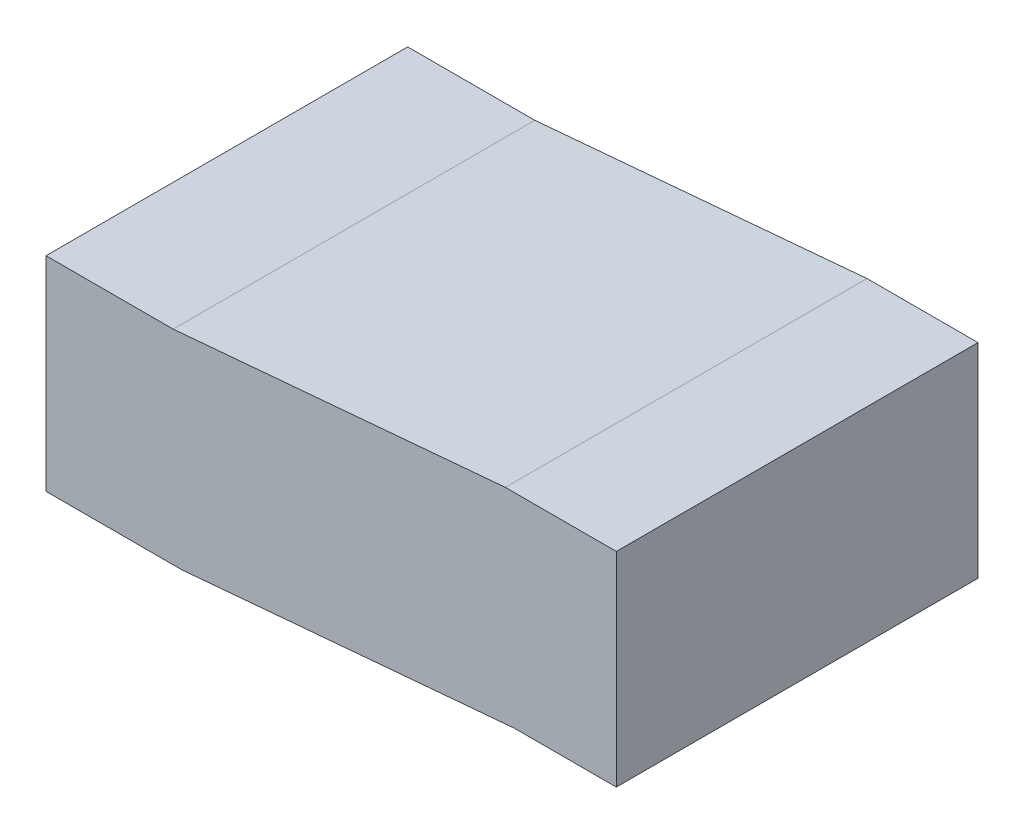
from build123d import *

# Parameters (mm, degrees)
BOSS_EXTRUDE1_DEPTH = 5316


with BuildPart() as part:
    # Sketch2 → Boss-Extrude1 (new body)
    with BuildSketch(Plane.XY):
        Polygon((0, 0), (2000, 0), (6882.5, 427.163399665), (8382.5, 427.163399665), (8382.5, 3427.163399665), (6751.517171274, 3427.163399665), (1869.017171274, 3000), (0, 3000), align=None)
    extrude(amount=BOSS_EXTRUDE1_DEPTH)


solid = part.part
